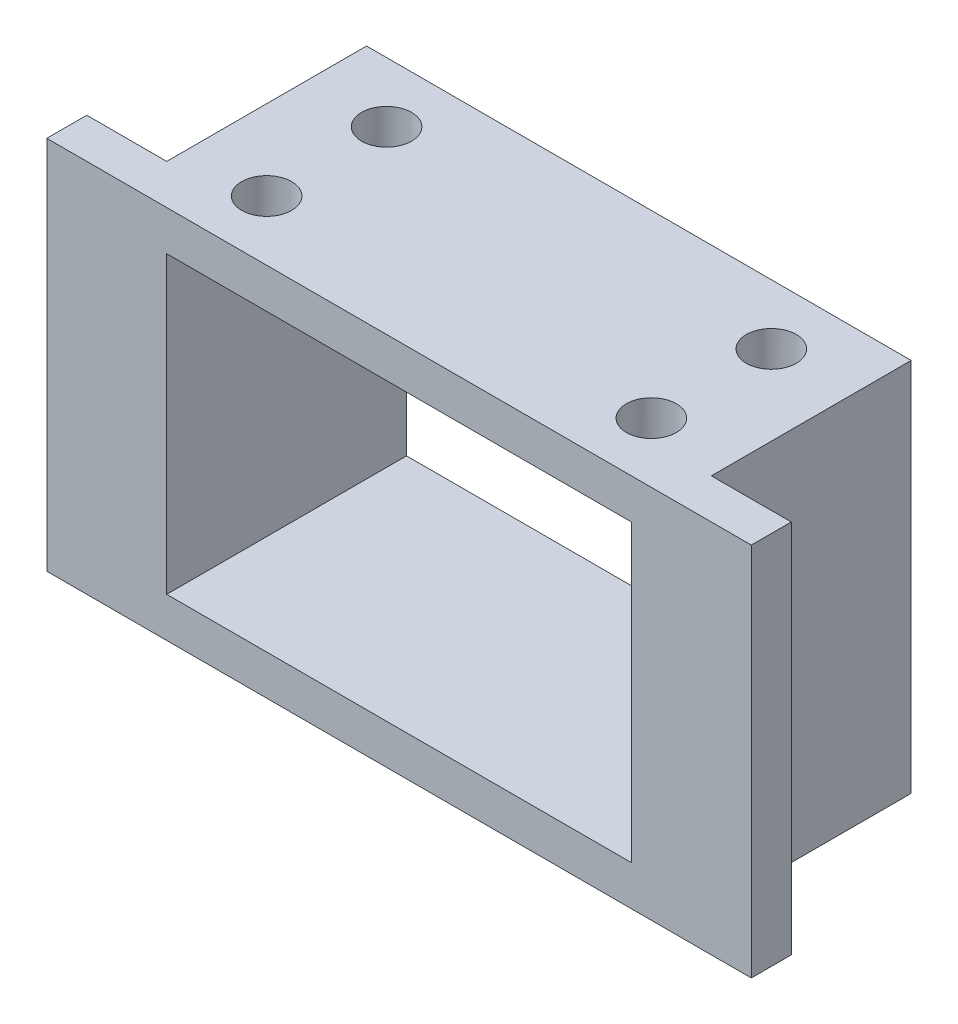
from build123d import *

# Parameters (mm, degrees)
SKETCH1_W            = 27.25
SKETCH1_H            = 18.76
SKETCH1_W_2          = 23.25
SKETCH1_H_2          = 14.76
BOSS_EXTRUDE1_DEPTH  = 18
SKETCH3_W            = 23.25
SKETCH3_H            = 14.76
BOSS_EXTRUDE2_DEPTH  = 2
SKETCH7_W            = 2
SKETCH7_H            = 5
CUT_EXTRUDE1_DEPTH   = 2
SKETCH10_W           = 23.25
SKETCH10_H           = 14.76
SKETCH10_W_2         = 7
SKETCH10_H_2         = 18.76
BOSS_EXTRUDE3_DEPTH  = 2
SKETCH11_R           = 1.5
CUT_EXTRUDE3_DEPTH   = 2
SKETCH12_R           = 1.5
CUT_EXTRUDE4_DEPTH   = 2
FILLET11_R           = 1
SKETCH13_W           = 3
SKETCH13_H           = 18.76
CUT_EXTRUDE5_DEPTH   = 10
CUT_EXTRUDE6_REACH   = 42.094
SKETCH14_W           = 27.25
SKETCH14_H           = 8
SKETCH16_W           = 23.25
SKETCH16_H           = 2
BOSS_EXTRUDE5_DEPTH  = 7.6
SKETCH19_W           = 2
SKETCH19_H           = 0.99
CUT_EXTRUDE8_DEPTH   = 10
BOSS_EXTRUDE6_DEPTH  = 4
SKETCH21_R           = 1.25
CUT_EXTRUDE9_DEPTH   = 2
BOSS_EXTRUDE7_DEPTH  = 1
CUT_EXTRUDE11_START  = -12
CUT_EXTRUDE11_DEPTH  = 12
SKETCH26_W           = 28.086287418
SKETCH26_H           = 15.375704791
CUT_EXTRUDE13_DEPTH  = 4
SKETCH27_W           = 24.075870352
SKETCH27_H           = 3.872197668
CUT_EXTRUDE14_DEPTH  = 12
SKETCH28_W           = 5.439700639
SKETCH28_H           = 5.036759851
BOSS_EXTRUDE8_DEPTH  = 2
SKETCH29_R           = 1.25
CUT_EXTRUDE15_DEPTH  = 2
SKETCH30_W           = 2
SKETCH30_H           = 0.99
BOSS_EXTRUDE9_DEPTH  = 10
SKETCH32_W           = 3.854176667
SKETCH32_H           = 5.494251846
SKETCH32_W_2         = 4.510206738
SKETCH32_H_2         = 5.863268761
BOSS_EXTRUDE11_DEPTH = 2
BOSS_EXTRUDE13_START = -2
BOSS_EXTRUDE13_DEPTH = 2


with BuildPart() as part:
    # Sketch1 → Boss-Extrude1 (new body)
    with BuildSketch(Plane.XY):
        with Locations((11.625, -7.38)):
            Rectangle(SKETCH1_W, SKETCH1_H)
        with Locations((11.625, -7.38)):
            Rectangle(SKETCH1_W_2, SKETCH1_H_2, mode=Mode.SUBTRACT)
    extrude(amount=BOSS_EXTRUDE1_DEPTH)

    # Sketch3 → Boss-Extrude2 (add)
    with BuildSketch(Plane(origin=(0, 0, 0), x_dir=(-1, 0, 0), z_dir=(0, 0, -1))):
        with Locations((-11.625, -7.38)):
            Rectangle(SKETCH3_W, SKETCH3_H)
    extrude(amount=-BOSS_EXTRUDE2_DEPTH)

    # Sketch7 → Cut-Extrude1 (cut)
    with BuildSketch(Plane.ZY.offset(2)):
        with Locations((3, -6.5)):
            Rectangle(SKETCH7_W, SKETCH7_H)
    extrude(amount=-CUT_EXTRUDE1_DEPTH, mode=Mode.SUBTRACT)

    # Sketch10 → Boss-Extrude3 (add)
    # profile 1 of 3: a face of its own
    with BuildSketch(Plane.XY.offset(18)):
        Polygon((-2, -0.03961342), (-2, 2), (-9, 2), (-9, -16.76), (-2, -16.76), (-2, -13.03961342), align=None)
    # profile 2 of 3: a face of its own
    with BuildSketch(Plane.XY.offset(18)):
        Polygon((25.25, 2), (-2, 2), (-2, -0.03961342), (-2, -13.03961342), (-2, -16.76), (25.25, -16.76), align=None)
        with Locations((11.625, -7.38)):
            Rectangle(SKETCH10_W, SKETCH10_H, mode=Mode.SUBTRACT)
    # profile 3 of 3: a face of its own
    with BuildSketch(Plane.XY.offset(18)):
        with Locations((28.75, -7.38)):
            Rectangle(SKETCH10_W_2, SKETCH10_H_2)
    extrude(amount=BOSS_EXTRUDE3_DEPTH)

    # Sketch11 → Cut-Extrude3 (cut)
    with BuildSketch(Plane(origin=(0, 0, 18), x_dir=(-1, 0, 0), z_dir=(0, 0, -1))):
        with Locations((3.5, -8.26)):
            Circle(SKETCH11_R)
    extrude(amount=-CUT_EXTRUDE3_DEPTH, mode=Mode.SUBTRACT)

    # Sketch12 → Cut-Extrude4 (cut)
    with BuildSketch(Plane(origin=(0, 0, 18), x_dir=(-1, 0, 0), z_dir=(0, 0, -1))):
        with Locations((-26.95, -8.26)):
            Circle(SKETCH12_R)
    extrude(amount=-CUT_EXTRUDE4_DEPTH, mode=Mode.SUBTRACT)

    # Fillet11
    fillet11_edges = [part.edges().sort_by_distance(p)[0] for p in [
        (0, -9, 3),
        (0, -4, 3),
        (0, -6.5, 4),
        (-2, -6.5, 4),
        (-2, -4, 3),
        (-2, -9, 3),
    ]]
    fillet(fillet11_edges, radius=FILLET11_R - 0.0001)  # a hair under: the kernel refuses the full size

    # Sketch13 → Cut-Extrude5 (cut)
    with BuildSketch(Plane(origin=(0, 0, 18), x_dir=(-1, 0, 0), z_dir=(0, 0, -1))):
        with Locations((-30.75, -7.38)):
            Rectangle(SKETCH13_W, SKETCH13_H)
        with Locations((7.5, -7.38)):
            Rectangle(SKETCH13_W, SKETCH13_H)
    extrude(amount=-CUT_EXTRUDE5_DEPTH, mode=Mode.SUBTRACT)

    # Cut-Extrude6: up to this face of the body (flat: up to its plane)
    cut_extrude6_end = Plane(part.part.faces().sort_by_distance((11.625, -16.76, 10.256684492))[0])
    # Sketch14 → Cut-Extrude6 (cut, up to the picked face)
    with BuildSketch(Plane(origin=(0, 2, 0), x_dir=(1, 0, 0), z_dir=(0, 1, 0)), mode=Mode.PRIVATE) as cut_extrude6_sk1:
        with Locations((11.625, -4)):
            Rectangle(SKETCH14_W, SKETCH14_H)
    cut_extrude6_tool1 = split(extrude(cut_extrude6_sk1.sketch, amount=-CUT_EXTRUDE6_REACH, mode=Mode.PRIVATE), bisect_by=cut_extrude6_end, keep=Keep.BOTH, mode=Mode.PRIVATE)
    add(cut_extrude6_tool1.solids().sort_by(Axis((11.625, 2, 4), (0, -1, 0)))[0], mode=Mode.SUBTRACT)

    # Sketch16 → Boss-Extrude5 (add)
    with BuildSketch(Plane.XY.offset(20)):
        with Locations((11.625, -15.76)):
            Rectangle(SKETCH16_W, SKETCH16_H)
    extrude(amount=BOSS_EXTRUDE5_DEPTH)

    # Sketch19 → Cut-Extrude8 (cut)
    with BuildSketch(Plane(origin=(0, 0, 8), x_dir=(-1, 0, 0), z_dir=(0, 0, -1))):
        with Locations((1, -7.255)):
            Rectangle(SKETCH19_W, SKETCH19_H)
        with Locations((-24.25, -7.255)):
            Rectangle(SKETCH19_W, SKETCH19_H)
    extrude(amount=-CUT_EXTRUDE8_DEPTH, mode=Mode.SUBTRACT)

    # Sketch20 → Boss-Extrude6 (add)
    with BuildSketch(Plane.XZ.offset(16.76)):
        with BuildLine():
            ThreePointArc((1.734487906, 14.866457564), (-0.15, 17.000000025), (1.734487955, 19.133542442))
            Line((1.734487955, 19.133542442), (4.661486136, 19.497797339))
            ThreePointArc((4.661486136, 19.497797339), (3.240091566, 20.432881138), (1.549246975, 20.622060423))
            ThreePointArc((1.549246975, 20.622060423), (0.742054746, 20.4263791), (0, 20.053276928))
            Line((0, 20.053276928), (0, 20))
            Line((0, 20), (-0.079062289, 20))
            ThreePointArc((-0.079062289, 20), (-1.544419903, 16.128456799), (1.549246968, 13.377939578))
            ThreePointArc((1.549246968, 13.377939578), (3.240091563, 13.567118861), (4.661486136, 14.502202661))
            Line((4.661486136, 14.502202661), (1.734487906, 14.866457564))
        make_face()
        with BuildLine():
            ThreePointArc((1.549246975, 20.622060423), (3.240091566, 20.432881138), (4.661486136, 19.497797339))
            Line((4.661486136, 19.497797339), (14.257253364, 20.691957699))
            ThreePointArc((14.257253364, 20.691957699), (15.89224684, 22.015782374), (17.896084422, 22.656368345))
            Line((17.896084422, 22.656368345), (1.549246975, 20.622060423))
        make_face()
        with BuildLine():
            ThreePointArc((17.896084422, 22.656368345), (15.89224684, 22.015782374), (14.257253364, 20.691957699))
            Line((14.257253364, 20.691957699), (18.081325153, 21.167850334))
            ThreePointArc((18.081325153, 21.167850334), (21.380428532, 20.14789091), (22.8, 17))
            ThreePointArc((22.8, 17), (21.380428595, 13.852109147), (18.081325321, 12.832149645))
            Line((18.081325321, 12.832149645), (14.257253364, 13.308042301))
            ThreePointArc((14.257253364, 13.308042301), (15.89224684, 11.984217626), (17.896084422, 11.343631655))
            ThreePointArc((17.896084422, 11.343631655), (22.37343883, 12.727862432), (24.3, 17))
            ThreePointArc((24.3, 17), (24.082512903, 18.559503854), (23.446648326, 20))
            Line((23.446648326, 20), (23.25, 20))
            Line((23.25, 20), (23.25, 20.296589146))
            ThreePointArc((23.25, 20.296589146), (20.898920406, 22.215837897), (17.896084422, 22.656368345))
        make_face()
        with BuildLine():
            Line((14.257253364, 13.308042301), (4.661486136, 14.502202661))
            ThreePointArc((4.661486136, 14.502202661), (3.240091563, 13.567118861), (1.549246968, 13.377939578))
            Line((1.549246968, 13.377939578), (17.896084422, 11.343631655))
            ThreePointArc((17.896084422, 11.343631655), (15.89224684, 11.984217626), (14.257253364, 13.308042301))
        make_face()
    extrude(amount=BOSS_EXTRUDE6_DEPTH)

    # Sketch21 → Cut-Extrude9 (cut)
    with BuildSketch(Plane.XZ.offset(16.76)):
        with Locations((18.6, 17)):
            Circle(SKETCH21_R)
    extrude(amount=-CUT_EXTRUDE9_DEPTH, mode=Mode.SUBTRACT)

    # Sketch23 → Boss-Extrude7 (add)
    with BuildSketch(Plane.XZ.offset(16.76)):
        Polygon((11.1, 21.100651295), (0.406174607, 19.998863224), (-0.954500861, 17.320033397), (0.387681288, 14.425953139), (11.1, 12.86779769), align=None)
    extrude(amount=BOSS_EXTRUDE7_DEPTH)

    # Sketch24 → Cut-Extrude11 (cut)
    with BuildSketch(Plane.XZ.offset(16.76).offset(CUT_EXTRUDE11_START)):
        with BuildLine():
            ThreePointArc((0, 20.053276928), (0.742054739, 20.426379098), (1.549246961, 20.622060422))
            Line((1.549246961, 20.622060422), (17.896084422, 22.656368345))
            ThreePointArc((17.896084422, 22.656368345), (20.898920406, 22.215837897), (23.25, 20.296589146))
            Line((23.25, 20.296589146), (23.25, 27.6))
            Line((23.25, 27.6), (0, 27.6))
            Line((0, 27.6), (0, 20.053276928))
        make_face()
    extrude(amount=CUT_EXTRUDE11_DEPTH, mode=Mode.SUBTRACT)

    # Sketch26 → Cut-Extrude13 (cut)
    with BuildSketch(Plane.XZ.offset(20.76)):
        with Locations((10.743459592, 18.384139078)):
            Rectangle(SKETCH26_W, SKETCH26_H)
    extrude(amount=-CUT_EXTRUDE13_DEPTH, mode=Mode.SUBTRACT)

    # Sketch27 → Cut-Extrude14 (cut)
    with BuildSketch(Plane(origin=(0, -16.76, 0), x_dir=(-1, 0, 0), z_dir=(0, -1, 0))):
        with Locations((-12.037935176, -21.936098834)):
            Rectangle(SKETCH27_W, SKETCH27_H)
    extrude(amount=-CUT_EXTRUDE14_DEPTH, mode=Mode.SUBTRACT)

    # Sketch28 → Boss-Extrude8 (add)
    with BuildSketch(Plane.XZ.offset(16.76)):
        with Locations((19.018963462, 16.417644729)):
            Rectangle(SKETCH28_W, SKETCH28_H)
    extrude(amount=-BOSS_EXTRUDE8_DEPTH)

    # Sketch29 → Cut-Extrude15 (cut)
    with BuildSketch(Plane(origin=(0, 2, 0), x_dir=(1, 0, 0), z_dir=(0, 1, 0))):
        with Locations(Location((2, -11, 0), (0, 0, 270))):
            Circle(SKETCH29_R)
        with Locations(Location((21.25, -11, 0), (0, 0, 270))):
            Circle(SKETCH29_R)
        with Locations(Location((2, -17, 0), (0, 0, 270))):
            Circle(SKETCH29_R)
        with Locations(Location((21.25, -17, 0), (0, 0, 270))):
            Circle(SKETCH29_R)
    extrude(amount=-CUT_EXTRUDE15_DEPTH, mode=Mode.SUBTRACT)

    # Sketch30 → Boss-Extrude9 (add)
    with BuildSketch(Plane(origin=(0, 0, 18), x_dir=(-1, 0, 0), z_dir=(0, 0, -1))):
        with Locations((-24.25, -7.255)):
            Rectangle(SKETCH30_W, SKETCH30_H)
        with Locations((1, -7.255)):
            Rectangle(SKETCH30_W, SKETCH30_H)
    extrude(amount=BOSS_EXTRUDE9_DEPTH)

    # Sketch32 → Boss-Extrude11 (add)
    with BuildSketch(Plane.XY.offset(20)):
        with Locations((-3.545695394, -6.231493422)):
            Rectangle(SKETCH32_W, SKETCH32_H)
        with Locations((26.590685996, -6.046984965)):
            Rectangle(SKETCH32_W_2, SKETCH32_H_2)
    extrude(amount=-BOSS_EXTRUDE11_DEPTH)

    # Sketch33 → Boss-Extrude13 (add)
    with BuildSketch(Plane.XY.offset(20).offset(BOSS_EXTRUDE13_START)):
        with BuildLine():
            Line((-2.183342779, -8.978619345), (-2.848663443, -8.978619345))
            Line((-2.848663443, -8.978619345), (-2.848663443, -9.611207123))
            ThreePointArc((-2.848663443, -9.611207123), (-2.466418023, -9.347064073), (-2.183342779, -8.978619345))
        make_face()
        with BuildLine():
            Line((-2.848663443, -9.611207123), (-2.848663443, -8.978619345))
            Line((-2.848663443, -8.978619345), (-4.816657221, -8.978619345))
            ThreePointArc((-4.816657221, -8.978619345), (-3.959025839, -9.688038963), (-2.848663443, -9.611207123))
        make_face()
        with BuildLine():
            ThreePointArc((28.266657221, -8.978619345), (26.95, -9.76), (25.633342779, -8.978619345))
            Line((25.633342779, -8.978619345), (28.266657221, -8.978619345))
        make_face()
    extrude(amount=BOSS_EXTRUDE13_DEPTH)


solid = part.part
